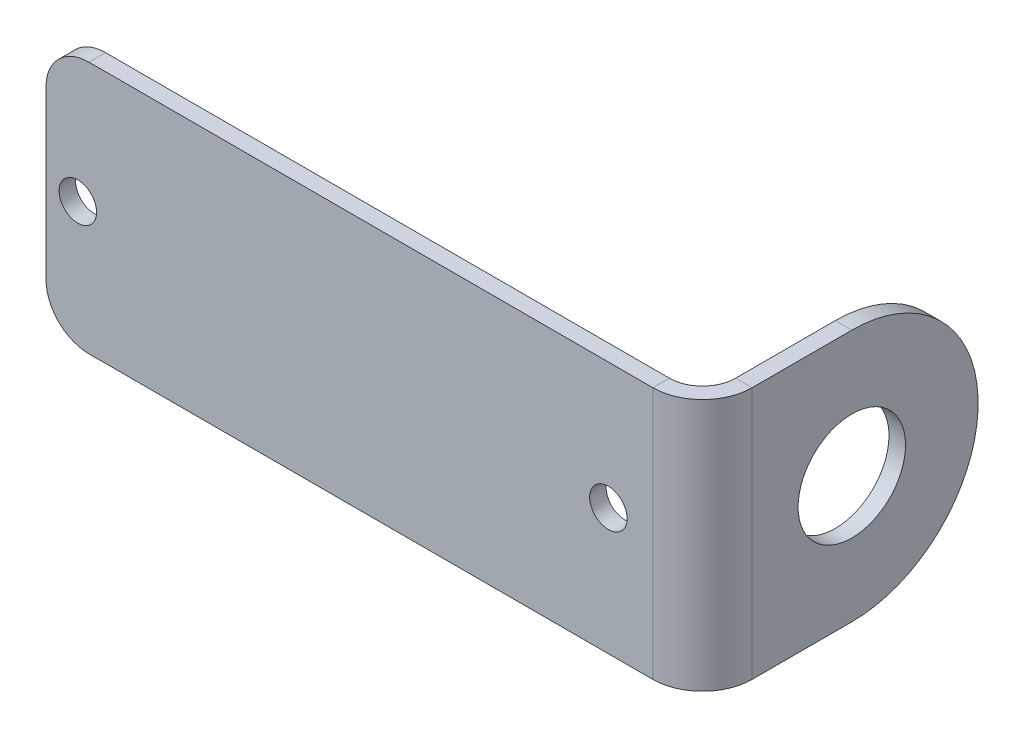
from build123d import *

# Parameters (mm, degrees)
SKETCH1_W                  = 53.93
SKETCH1_H                  = 22.93
BOSS_EXTRUDE1_DEPTH        = 1.5
M3_CLEARANCE_HOLE1_D       = 3.4
M3_CLEARANCE_HOLE1_DEPTH   = 27
M3_CLEARANCE_HOLE1_TIP     = 1.021463052
FILLET1_R                  = 3.9
BOSS_EXTRUDE2_START        = -1.5
SKETCH4_R                  = 4.875
BOSS_EXTRUDE2_DEPTH        = 1.5
SKETCHED_START             = 32.144466887
SKETCHED_BEND1_OUTLINE_W   = 22.93
SKETCHED_BEND1_OUTLINE_H   = 1.5
SKETCHED_BEND1_DEPTH       = 23.855533113
SKETCHED_START_2           = 28.119756887
SKETCHED_BEND1_2_OUTLINE_R = 4.875
SKETCHED_BEND1_2_DEPTH     = 4.5
SKETCHED_START_3           = -11.465
SKETCHED_BEND1_3_DEPTH     = 22.93


with BuildPart() as part:
    # Sketch1 → Boss-Extrude1 (new body)
    with BuildSketch(Plane.XY.offset(1.5)):
        Rectangle(SKETCH1_W, SKETCH1_H)
    extrude(amount=-BOSS_EXTRUDE1_DEPTH)

    # M3 Clearance Hole1
    with Locations(Plane.XY.offset(1.5)):
        with Locations((-24.0755, 0), (24.0755, 0)):
            Hole(M3_CLEARANCE_HOLE1_D / 2, depth=M3_CLEARANCE_HOLE1_DEPTH)
            with Locations((0, 0, -(M3_CLEARANCE_HOLE1_DEPTH + M3_CLEARANCE_HOLE1_TIP / 2))):  # 118° drill point
                Cone(0, M3_CLEARANCE_HOLE1_D / 2, M3_CLEARANCE_HOLE1_TIP, mode=Mode.SUBTRACT)

    # Fillet1
    fillet1_edges = [part.edges().sort_by_distance(p)[0] for p in [
        (-26.965, -11.465, 0.75),
        (-26.965, 11.465, 0.75),
        (26.965, 11.465, 0.75),
        (26.965, -11.465, 0.75),
    ]]
    fillet(fillet1_edges, radius=FILLET1_R)

    # Sketch4 → Boss-Extrude2 (add)
    with BuildSketch(Plane.XY.offset(1.5).offset(BOSS_EXTRUDE2_START)):
        with BuildLine():
            Line((23.065, 11.465), (43.065, 11.465))
            ThreePointArc((43.065, 11.465), (54.53, 0), (43.065, -11.465))
            Line((43.065, -11.465), (23.065, -11.465))
            ThreePointArc((23.065, -11.465), (25.822716447, -10.322716447), (26.965, -7.565))
            Line((26.965, -7.565), (26.965, 7.565))
            ThreePointArc((26.965, 7.565), (25.822716447, 10.322716447), (23.065, 11.465))
        make_face()
        with Locations((43.065, 0)):
            Circle(SKETCH4_R, mode=Mode.SUBTRACT)
    extrude(amount=BOSS_EXTRUDE2_DEPTH)

    # Sketched Bend1: read off the stored shape, not the designer's step
    # Sketched Bend1 outline → Sketched Bend1 (cut)
    with BuildSketch(Plane.YZ.offset(SKETCHED_START)):
        with Locations((0, 0.75)):
            Rectangle(SKETCHED_BEND1_OUTLINE_W, SKETCHED_BEND1_OUTLINE_H)
    extrude(amount=SKETCHED_BEND1_DEPTH, mode=Mode.SUBTRACT)

    # Sketched Bend1 2 outline → Sketched Bend1 2 (add)
    with BuildSketch(Plane.YZ.offset(SKETCHED_START_2)):
        with BuildLine():
            Line((-11.465, 0), (-11.465, -12.054756887))
            ThreePointArc((-11.465, -12.054756887), (0, -23.519756887), (11.465, -12.054756887))
            Line((11.465, -12.054756887), (11.465, 0))
            Line((11.465, 0), (-11.465, 0))
        make_face()
        with Locations((0, -12.054756887)):
            Circle(SKETCHED_BEND1_2_OUTLINE_R, mode=Mode.SUBTRACT)
    extrude(amount=SKETCHED_BEND1_2_DEPTH)

    # Sketched Bend1 3 outline → Sketched Bend1 3 (cut)
    with BuildSketch(Plane(origin=(0, 0, 0), x_dir=(1, 0, 0), z_dir=(0, 1, 0)).offset(SKETCHED_START_3)):
        with BuildLine():
            ThreePointArc((28.119756887, 0), (30.241077231, 0.878679656), (31.119756887, 3))
            Line((31.119756887, 3), (31.119756887, 25))
            Line((31.119756887, 25), (28.119756887, 25))
            Line((28.119756887, 25), (28.119756887, 0))
        make_face()
        with BuildLine():
            Line((32.619756887, 0), (32.619756887, 3))
            ThreePointArc((32.619756887, 3), (31.301737402, -0.181980515), (28.119756887, -1.5))
            Line((28.119756887, -1.5), (27, -1.5))
            Line((27, -1.5), (27, -3))
            Line((27, -3), (32.144466887, -3))
            Line((32.144466887, -3), (32.144466887, 0))
            Line((32.144466887, 0), (32.619756887, 0))
        make_face()
    extrude(amount=SKETCHED_BEND1_3_DEPTH, mode=Mode.SUBTRACT)


solid = part.part
